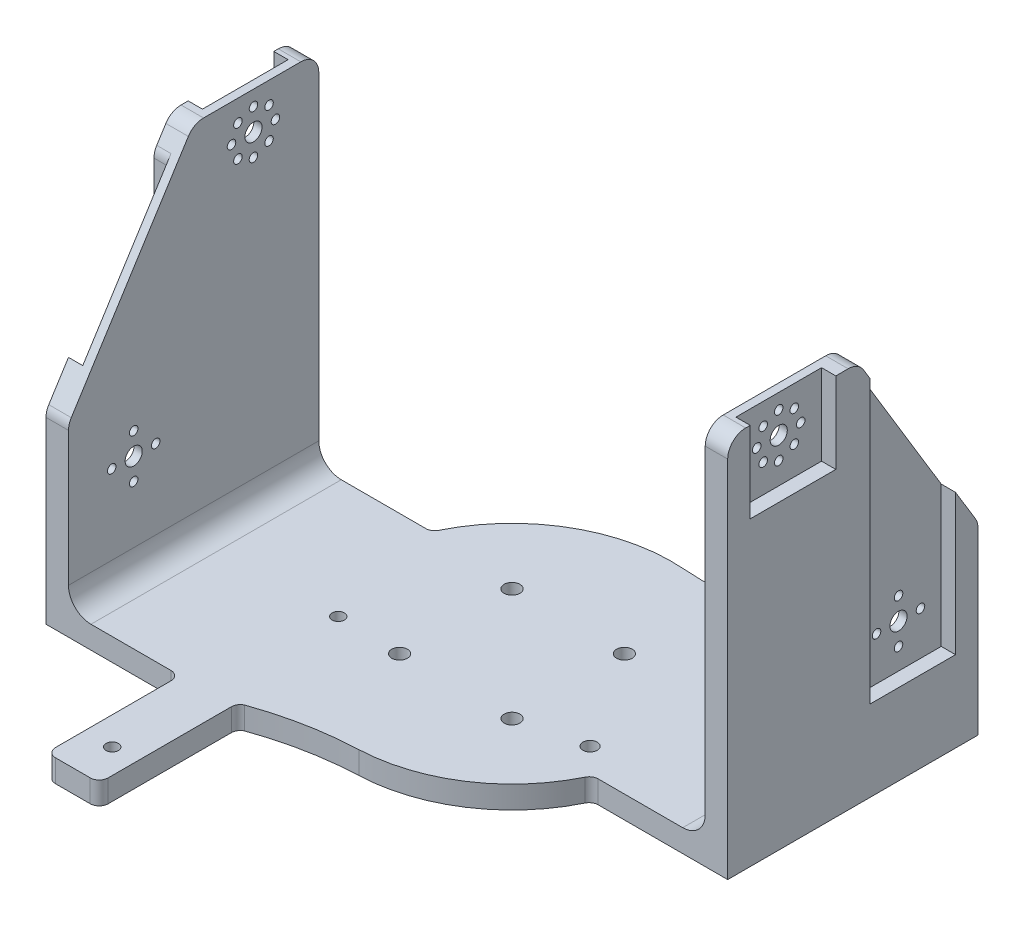
from build123d import *

# Parameters (mm, degrees)
SKETCH2_W                      = 230
SKETCH2_H                      = 283.251
BOSS_EXTRUDE1_DEPTH            = 10
SKETCH3_W                      = 10
SKETCH3_H                      = 283.251
BOSS_EXTRUDE2_DEPTH            = 170
M6_CLEARANCE_HOLE1_D           = 7
CUT_EXTRUDE1_DEPTH             = 327.431895271
CUT_EXTRUDE1_DEPTH_BACK        = 327.431895271
SKETCH7_R                      = 3.81
SKETCH7_R_2                    = 1.89865
SKETCH8_W                      = 6.35
SKETCH8_H                      = 38.1
CUT_EXTRUDE2_DEPTH             = 36.025
CUT_EXTRUDE3_DEPTH             = 6.35
CUT_EXTRUDE4_REACH             = 331.125
SKETCH11_R                     = 3.81
F_6_CLEARANCE_HOLE1_D          = 3.7973
F_6_CLEARANCE_HOLE1_DEPTH      = 3.65
CIRPATTERN1_COUNT              = 2
ENL_V_MAT_EXTRU_1_REACH        = 249.554
ESQUISSE1_R                    = 3.175
CBORE_FOR_M5_SHCS1_D           = 5.5
CBORE_FOR_M5_SHCS1_CBORE_D     = 10
CBORE_FOR_M5_SHCS1_CBORE_DEPTH = 5
CUT_EXTRUDE5_DEPTH             = 248.553594703
CUT_EXTRUDE5_DEPTH_BACK        = 248.553594703
SKETCH15_W                     = 58.825
SKETCH15_H                     = 59.331356017
CUT_EXTRUDE7_DEPTH             = 248.553594703
CUT_EXTRUDE7_DEPTH_BACK        = 248.553594703
SKETCH20_W                     = 0.765
SKETCH20_H                     = 59.331356017
FILLET2_R                      = 4
FILLET3_R                      = 144
FILLET4_R                      = 4
CUT_EXTRUDE8_REACH             = 335.853
CUT_EXTRUDE9_REACH             = 335.853
FILLET5_R                      = 8
FILLET6_R                      = 8
FILLET7_R                      = 10


with BuildPart() as part:
    # Sketch2 → Boss-Extrude1 (new body)
    with BuildSketch(Plane(origin=(0, 0, 0), x_dir=(1, 0, 0), z_dir=(0, 1, 0))):
        Rectangle(SKETCH2_W, SKETCH2_H)
    extrude(amount=BOSS_EXTRUDE1_DEPTH)

    # Sketch3 → Boss-Extrude2 (add)
    with BuildSketch(Plane(origin=(0, 0, 0), x_dir=(1, 0, 0), z_dir=(0, 1, 0))):
        with Locations((-120, 0)):
            Rectangle(SKETCH3_W, SKETCH3_H)
        with Locations((120, 0)):
            Rectangle(SKETCH3_W, SKETCH3_H)
    extrude(amount=BOSS_EXTRUDE2_DEPTH)

    # M6 Clearance Hole1 (through all)
    with Locations(Plane(origin=(0, 10, 0), x_dir=(1, 0, 0), z_dir=(0, 1, 0))):
        with Locations((-25, 25), (25, 25), (25, -25), (-25, -25)):
            Hole(M6_CLEARANCE_HOLE1_D / 2)

    # Sketch7 → Cut-Extrude1 (cut, two sides: drawn at the far end of the back side and taken through both)
    with BuildSketch(Plane.ZY.offset(-115).offset(-CUT_EXTRUDE1_DEPTH_BACK)):
        with Locations((0, 153.49)):
            Circle(SKETCH7_R)
        with Locations((0, 163.269)):
            Circle(SKETCH7_R_2)
        with Locations((6.914797213, 160.404797213)):
            Circle(SKETCH7_R_2)
        with Locations((9.779, 153.49)):
            Circle(SKETCH7_R_2)
        with Locations((6.914797213, 146.575202787)):
            Circle(SKETCH7_R_2)
        with Locations((0, 143.711)):
            Circle(SKETCH7_R_2)
        with Locations((-6.914797213, 146.575202787)):
            Circle(SKETCH7_R_2)
        with Locations((-9.779, 153.49)):
            Circle(SKETCH7_R_2)
        with Locations((-6.914797213, 160.404797213)):
            Circle(SKETCH7_R_2)
    extrude(amount=CUT_EXTRUDE1_DEPTH + CUT_EXTRUDE1_DEPTH_BACK, mode=Mode.SUBTRACT)

    # Sketch8 → Cut-Extrude2 (cut)
    with BuildSketch(Plane(origin=(0, 170, 0), x_dir=(1, 0, 0), z_dir=(0, 1, 0))):
        with Locations((121.825, 0)):
            Rectangle(SKETCH8_W, SKETCH8_H)
        with Locations((-121.825, 0)):
            Rectangle(SKETCH8_W, SKETCH8_H)
    extrude(amount=-CUT_EXTRUDE2_DEPTH, mode=Mode.SUBTRACT)

    # Sketch9 → Cut-Extrude3 (cut)
    with BuildSketch(Plane(origin=(125, 0, 0), x_dir=(0, 0, -1), z_dir=(1, 0, 0))):
        Polygon((72.294143983, 74.514), (72.294143983, 35.986), (34.274143983, 35.986), (34.274143983, 74.514), (34.274143983, 170), (72.294143983, 170), align=None)
    cut_extrude3 = extrude(amount=-CUT_EXTRUDE3_DEPTH, mode=Mode.SUBTRACT)

    # Sketch11 → Cut-Extrude4 (cut, up to next)
    with BuildSketch(Plane(origin=(118.65, 0, 0), x_dir=(0, 0, -1), z_dir=(1, 0, 0)), mode=Mode.PRIVATE) as cut_extrude4_sk1:
        with Locations((53.284143983, 55.25)):
            Circle(SKETCH11_R)
    cut_extrude4_tool1 = extrude(cut_extrude4_sk1.sketch, amount=-CUT_EXTRUDE4_REACH, mode=Mode.PRIVATE) & part.part
    cut_extrude4 = cut_extrude4_tool1.solids().sort_by_distance((118.65, 55.25, -53.284144))[0]
    add(cut_extrude4, mode=Mode.SUBTRACT)

    # #6 Clearance Hole1
    with Locations(Plane(origin=(118.65, 0, 0), x_dir=(0, 0, -1), z_dir=(1, 0, 0))):
        with Locations((53.284143983, 65.029), (43.505143983, 55.25), (63.063143983, 55.25), (53.284143983, 45.471)):
            f_6_clearance_hole1 = Hole(F_6_CLEARANCE_HOLE1_D / 2, depth=F_6_CLEARANCE_HOLE1_DEPTH)

    # CirPattern1: Cut-Extrude3, Cut-Extrude4, #6 Clearance Hole1 ×2 about axis
    cirpattern1_axis = Axis((0, 0, 0), (0, 1, 0))
    add([cut_extrude3.rotate(cirpattern1_axis, i * 360 / CIRPATTERN1_COUNT) for i in range(1, CIRPATTERN1_COUNT)], mode=Mode.SUBTRACT)
    add([cut_extrude4.rotate(cirpattern1_axis, i * 360 / CIRPATTERN1_COUNT) for i in range(1, CIRPATTERN1_COUNT)], mode=Mode.SUBTRACT)
    add([f_6_clearance_hole1.rotate(cirpattern1_axis, i * 360 / CIRPATTERN1_COUNT) for i in range(1, CIRPATTERN1_COUNT)], mode=Mode.SUBTRACT)

    # Esquisse1 → Enlèv. mat.-Extru.1 (cut, up to next)
    with BuildSketch(Plane(origin=(0, 10, 0), x_dir=(1, 0, 0), z_dir=(0, 1, 0)), mode=Mode.PRIVATE) as enl_v_mat_extru_1_sk1:
        with Locations(Location((53, 82.268595163, 0), (0, 0, 270))):
            Circle(ESQUISSE1_R)
    enl_v_mat_extru_1_tool1 = extrude(enl_v_mat_extru_1_sk1.sketch, amount=-ENL_V_MAT_EXTRU_1_REACH, mode=Mode.PRIVATE) & part.part
    # Esquisse1 → Enlèv. mat.-Extru.1 (cut, up to next)
    with BuildSketch(Plane(origin=(0, 10, 0), x_dir=(1, 0, 0), z_dir=(0, 1, 0)), mode=Mode.PRIVATE) as enl_v_mat_extru_1_sk2:
        with Locations(Location((53, -18.267555417, 0), (0, 0, 270))):
            Circle(ESQUISSE1_R)
    enl_v_mat_extru_1_tool2 = extrude(enl_v_mat_extru_1_sk2.sketch, amount=-ENL_V_MAT_EXTRU_1_REACH, mode=Mode.PRIVATE) & part.part
    add(enl_v_mat_extru_1_tool1.solids().sort_by_distance((53, 10, -82.268595))[0], mode=Mode.SUBTRACT)
    add(enl_v_mat_extru_1_tool2.solids().sort_by_distance((53, 10, 18.267555))[0], mode=Mode.SUBTRACT)

    # CBORE for M5 SHCS1 (through all)
    with Locations(Plane(origin=(0, 0, 0), x_dir=(-1, 0, 0), z_dir=(0, -1, 0))):
        with Locations((53, -24.299692803), (53, -124.835843383)):
            CounterBoreHole(CBORE_FOR_M5_SHCS1_D / 2, CBORE_FOR_M5_SHCS1_CBORE_D / 2, CBORE_FOR_M5_SHCS1_CBORE_DEPTH)

    # Sketch15 → Cut-Extrude5 (cut, two sides: drawn at the far end of the back side and taken through both)
    with BuildSketch(Plane(origin=(0, 10, 0), x_dir=(1, 0, 0), z_dir=(0, 1, 0)).offset(-CUT_EXTRUDE5_DEPTH_BACK)):
        with BuildLine():
            Line((125, 141.6255), (-125, 141.6255))
            Line((-125, 141.6255), (-125, 29.05))
            Line((-125, 29.05), (-64.845300659, 29.05))
            ThreePointArc((-64.845300659, 29.05), (-19.453683623, 68.340103242), (39.825, 58.845432215))
            Line((39.825, 58.845432215), (39.825, 95.443595163))
            Line((39.825, 95.443595163), (66.175, 95.443595163))
            Line((66.175, 95.443595163), (66.175, 82.294143983))
            Line((66.175, 82.294143983), (125, 82.294143983))
            Line((125, 82.294143983), (125, 141.6255))
        make_face()
        with BuildLine():
            Line((125, -141.6255), (125, -29.05))
            Line((125, -29.05), (64.845300659, -29.05))
            ThreePointArc((64.845300659, -29.05), (19.453683623, -68.340103242), (-39.825, -58.845432215))
            Line((-39.825, -58.845432215), (-39.825, -141.6255))
            Line((-39.825, -141.6255), (125, -141.6255))
        make_face()
        with Locations((-95.5875, -111.959821992)):
            Rectangle(SKETCH15_W, SKETCH15_H)
    extrude(amount=CUT_EXTRUDE5_DEPTH + CUT_EXTRUDE5_DEPTH_BACK, mode=Mode.SUBTRACT)

    # Sketch20 → Cut-Extrude7 (cut, two sides: drawn at the far end of the back side and taken through both)
    with BuildSketch(Plane(origin=(0, 10, 0), x_dir=(1, 0, 0), z_dir=(0, 1, 0)).offset(-CUT_EXTRUDE7_DEPTH_BACK)):
        with Locations((-65.7925, -111.959821992)):
            Rectangle(SKETCH20_W, SKETCH20_H)
        with BuildLine():
            Line((-39.824999998, -141.6255), (-39.824999998, -79.27802459))
            ThreePointArc((-39.824999998, -79.27802459), (-41.410278354, -80.751625782), (-41.995854347, -82.835302509))
            Line((-41.995854347, -82.835302509), (-41.995854347, -141.6255))
            Line((-41.995854347, -141.6255), (-39.824999998, -141.6255))
        make_face()
        with BuildLine():
            Line((39.825, 95.443595163), (66.175, 95.443595163))
            Line((66.175, 95.443595163), (66.175, 82.294143983))
            Line((66.175, 82.294143983), (65.41, 82.294143983))
            Line((65.41, 82.294143983), (65.41, 88.113136011))
            ThreePointArc((65.41, 88.113136011), (64.238427125, 90.941563136), (61.41, 92.113136011))
            Line((61.41, 92.113136011), (46, 92.113136011))
            ThreePointArc((46, 92.113136011), (43.171572875, 90.941563136), (42, 88.113136011))
            Line((42, 88.113136011), (42, 76.113136011))
            ThreePointArc((42, 76.113136011), (41.413209633, 74.02747065), (39.825, 72.553729459))
            Line((39.825, 72.553729459), (39.825, 95.443595163))
        make_face()
    extrude(amount=CUT_EXTRUDE7_DEPTH + CUT_EXTRUDE7_DEPTH_BACK, mode=Mode.SUBTRACT)

    # Fillet2
    fillet2_edges = [part.edges().sort_by_distance(p)[0] for p in [
        (-65.41, 5, 141.6255),
        (-41.995854347, 5, 141.6255),
    ]]
    fillet(fillet2_edges, radius=FILLET2_R)

    # Fillet3
    # the kernel refuses this fillet: 144 mm, written as the material it adds along each edge
    with BuildSketch(Plane(origin=(39.825, 0, -58.845432215), x_dir=(-0.9448497264443181, 0, -0.3275041899550252), z_dir=(0, 1, 0))) as fillet3_piece_1:
        with BuildLine():
            CenterArc((73.914316816, -139.111696925), FILLET3_R, 104.971721204, 13.852011514)
            Line((4.489524785, -12.952280901), (0, 0))
            ThreePointArc((0, 0), (18.356514745, -2.412072644), (36.713029491, 0))
        make_face()
    extrude(amount=10)
    with BuildSketch(Plane(origin=(-39.825, 10, 58.845432215), x_dir=(1.16727742405119e-10, 0, 1.0), z_dir=(0, -1, 0))) as fillet3_piece_2:
        with BuildLine():
            CenterArc((156.036482988, -48.451881806), FILLET3_R, 160.337962033, 17.363014277)
            ThreePointArc((12.15239164, -42.675355439), (9.492802158, -20.364752295), (0, 0))
            Line((0, 0), (20.432592375, 0))
        make_face()
    extrude(amount=10)

    # Fillet4
    fillet4_edges = [part.edges().sort_by_distance(p)[0] for p in [
        (-64.845300659, 5, -29.05),
        (64.845300659, 5, 29.05),
        (-65.41, 5, 82.294143983),
        (65.41, 5, -82.294143983),
    ]]
    fillet(fillet4_edges, radius=FILLET4_R)

    # Sketch22 → Cut-Extrude8 (cut, up to next)
    with BuildSketch(Plane.ZY.offset(125), mode=Mode.PRIVATE) as cut_extrude8_sk1:
        Polygon((26.622071991, 170), (82.294143983, 82.011), (82.294143983, 170), align=None)
    cut_extrude8_tool1 = extrude(cut_extrude8_sk1.sketch, amount=-CUT_EXTRUDE8_REACH, mode=Mode.PRIVATE) & part.part
    add(cut_extrude8_tool1.solids().sort_by_distance((-125, 140.670333, 63.736787))[0], mode=Mode.SUBTRACT)

    # Sketch23 → Cut-Extrude9 (cut, up to next)
    with BuildSketch(Plane(origin=(125, 0, 0), x_dir=(0, 0, -1), z_dir=(1, 0, 0)), mode=Mode.PRIVATE) as cut_extrude9_sk1:
        Polygon((29.05, 170), (82.294143983, 82.011), (82.294143983, 170), align=None)
    cut_extrude9_tool1 = extrude(cut_extrude9_sk1.sketch, amount=-CUT_EXTRUDE9_REACH, mode=Mode.PRIVATE) & part.part
    add(cut_extrude9_tool1.solids().sort_by_distance((125, 140.670333, -64.546096))[0], mode=Mode.SUBTRACT)

    # Fillet5
    fillet5_edges = [part.edges().sort_by_distance(p)[0] for p in [
        (-120, 170, -29.05),
        (120, 170, 29.05),
        (-120, 82.011, 82.294143983),
        (-120, 170, 26.622071991),
        (120, 170, -29.05),
        (120, 82.011, -82.294143983),
    ]]
    fillet(fillet5_edges, radius=FILLET5_R)

    # Fillet6
    fillet6_edges = [part.edges().sort_by_distance(p)[0] for p in [
        (-121.825, 157.905997776, 34.274143983),
    ]]
    fillet(fillet6_edges, radius=FILLET6_R)

    # Fillet7
    fillet7_edges = [part.edges().sort_by_distance(p)[0] for p in [
        (115, 10, -26.622071991),
        (-115, 10, 26.622071991),
    ]]
    fillet(fillet7_edges, radius=FILLET7_R)


solid = part.part
